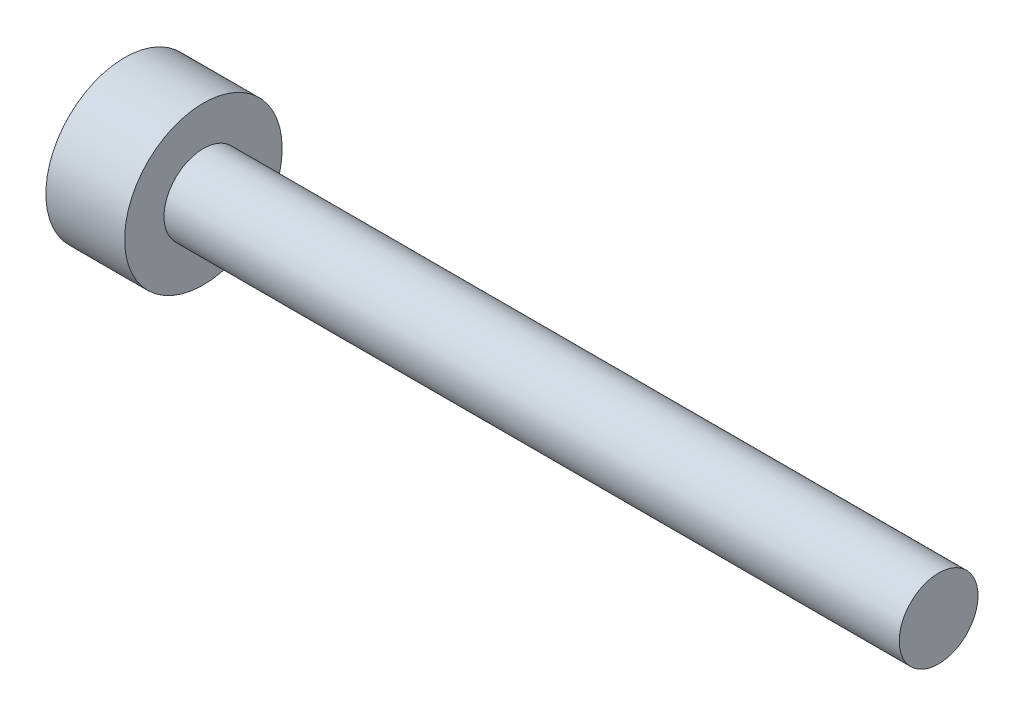
from build123d import *

# Parameters (mm, degrees)
SKETCH1_R           = 3
BOSS_EXTRUDE1_DEPTH = 3
SKETCH2_R           = 1.5
BOSS_EXTRUDE2_DEPTH = 28


with BuildPart() as part:
    # Sketch1 → Boss-Extrude1 (new body)
    with BuildSketch(Plane(origin=(0, 0, 0), x_dir=(0, 0, -1), z_dir=(1, 0, 0))):
        Circle(SKETCH1_R)
    extrude(amount=BOSS_EXTRUDE1_DEPTH)

    # Sketch2 → Boss-Extrude2 (add)
    with BuildSketch(Plane(origin=(3, 0, 0), x_dir=(0, 0, -1), z_dir=(1, 0, 0))):
        Circle(SKETCH2_R)
    extrude(amount=BOSS_EXTRUDE2_DEPTH)


solid = part.part
